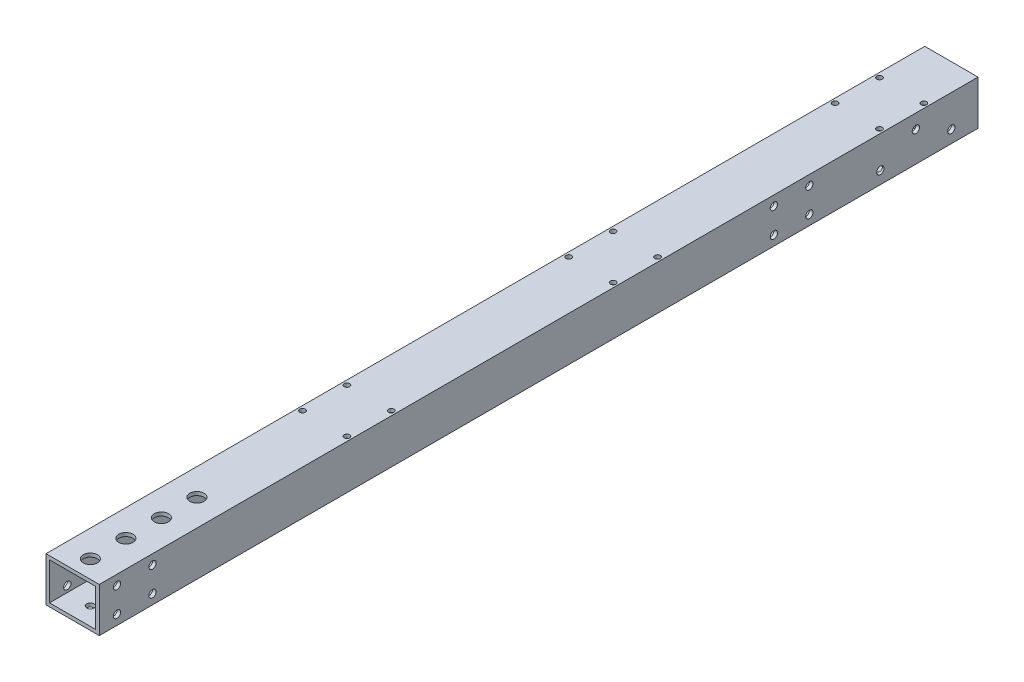
from build123d import *

# Parameters (mm, degrees)
SKETCH_1_W           = 30
SKETCH_1_H           = 25
SKETCH_1_W_2         = 26
SKETCH_1_H_2         = 21
EXTRUDE_1_DEPTH      = 510
CUT_EXTRUDE_4_REACH  = 512.833
SKETCH_7_R           = 2.05
CUT_EXTRUDE_7_DEPTH  = 512.03449003
SKETCH_9_R           = 2.05
CUT_EXTRUDE_9_DEPTH  = 10
SKETCH_10_R          = 4
CUT_EXTRUDE_10_DEPTH = 10
SKETCH_11_R          = 2.05
CUT_EXTRUDE_11_DEPTH = 52
SKETCH_12_W          = 15
SKETCH_12_H          = 25
CUT_EXTRUDE_12_DEPTH = 512.03449003
CUT_EXTRUDE_13_REACH = 512.833
SKETCH_5_R           = 1.55


with BuildPart() as part:
    # 草图1 → 凸台-拉伸1 (new body)
    with BuildSketch(Plane.XY):
        Rectangle(SKETCH_1_W, SKETCH_1_H)
        Rectangle(SKETCH_1_W_2, SKETCH_1_H_2, mode=Mode.SUBTRACT)
    extrude(amount=EXTRUDE_1_DEPTH)

    # 草图4 → 切除-拉伸4 (cut, up to next)
    with BuildSketch(Plane.XZ.offset(12.5), mode=Mode.PRIVATE) as cut_extrude_4_sk1:
        with BuildLine():
            Line((-7.5, 40), (-7.5, 60))
            ThreePointArc((-7.5, 60), (0, 67.5), (7.5, 60))
            Line((7.5, 60), (7.5, 40))
            ThreePointArc((7.5, 40), (0, 32.5), (-7.5, 40))
        make_face()
    cut_extrude_4_tool1 = extrude(cut_extrude_4_sk1.sketch, amount=-CUT_EXTRUDE_4_REACH, mode=Mode.PRIVATE) & part.part
    # 草图4 → 切除-拉伸4 (cut, up to next)
    with BuildSketch(Plane.XZ.offset(12.5), mode=Mode.PRIVATE) as cut_extrude_4_sk2:
        with BuildLine():
            Line((-7.5, 190), (-7.5, 210))
            ThreePointArc((-7.5, 210), (0, 217.5), (7.5, 210))
            Line((7.5, 210), (7.5, 190))
            ThreePointArc((7.5, 190), (0, 182.5), (-7.5, 190))
        make_face()
    cut_extrude_4_tool2 = extrude(cut_extrude_4_sk2.sketch, amount=-CUT_EXTRUDE_4_REACH, mode=Mode.PRIVATE) & part.part
    # 草图4 → 切除-拉伸4 (cut, up to next)
    with BuildSketch(Plane.XZ.offset(12.5), mode=Mode.PRIVATE) as cut_extrude_4_sk3:
        with BuildLine():
            Line((-7.5, 340), (-7.5, 360))
            ThreePointArc((-7.5, 360), (0, 367.5), (7.5, 360))
            Line((7.5, 360), (7.5, 340))
            ThreePointArc((7.5, 340), (0, 332.5), (-7.5, 340))
        make_face()
    cut_extrude_4_tool3 = extrude(cut_extrude_4_sk3.sketch, amount=-CUT_EXTRUDE_4_REACH, mode=Mode.PRIVATE) & part.part
    add(cut_extrude_4_tool1.solids().sort_by_distance((0, -12.5, 50))[0], mode=Mode.SUBTRACT)
    add(cut_extrude_4_tool2.solids().sort_by_distance((0, -12.5, 200))[0], mode=Mode.SUBTRACT)
    add(cut_extrude_4_tool3.solids().sort_by_distance((0, -12.5, 350))[0], mode=Mode.SUBTRACT)

    # 草图7 → 切除-拉伸7 (cut, through all)
    with BuildSketch(Plane(origin=(15, 0, 0), x_dir=(0, 0, -1), z_dir=(1, 0, 0))):
        with Locations((-30, -5.5)):
            Circle(SKETCH_7_R)
        with Locations((-50, 4.5)):
            Circle(SKETCH_7_R)
        with Locations((-70, -5.5)):
            Circle(SKETCH_7_R)
    extrude(amount=-CUT_EXTRUDE_7_DEPTH, mode=Mode.SUBTRACT)

    # 草图9 → 切除-拉伸9 (cut)
    with BuildSketch(Plane.XZ.offset(12.5)):
        with Locations((0, 480)):
            Circle(SKETCH_9_R)
        with Locations((0, 500)):
            Circle(SKETCH_9_R)
        with Locations((0, 440)):
            Circle(SKETCH_9_R)
        with Locations((0, 460)):
            Circle(SKETCH_9_R)
    extrude(amount=-CUT_EXTRUDE_9_DEPTH, mode=Mode.SUBTRACT)

    # 草图10 → 切除-拉伸10 (cut)
    with BuildSketch(Plane(origin=(0, 12.5, 0), x_dir=(1, 0, 0), z_dir=(0, 1, 0))):
        with Locations((0, -500)):
            Circle(SKETCH_10_R)
        with Locations((0, -480)):
            Circle(SKETCH_10_R)
        with Locations((0, -460)):
            Circle(SKETCH_10_R)
        with Locations((0, -440)):
            Circle(SKETCH_10_R)
    extrude(amount=-CUT_EXTRUDE_10_DEPTH, mode=Mode.SUBTRACT)

    # 草图11 → 切除-拉伸11 (cut)
    with BuildSketch(Plane.ZY.offset(15)):
        with Locations((480, 7)):
            Circle(SKETCH_11_R)
        with Locations((500, 7)):
            Circle(SKETCH_11_R)
        with Locations((480, -7)):
            Circle(SKETCH_11_R)
        with Locations((500, -7)):
            Circle(SKETCH_11_R)
        with Locations((110, 7)):
            Circle(SKETCH_11_R)
        with Locations((130, 7)):
            Circle(SKETCH_11_R)
        with Locations((110, -7)):
            Circle(SKETCH_11_R)
        with Locations((130, -7)):
            Circle(SKETCH_11_R)
    extrude(amount=-CUT_EXTRUDE_11_DEPTH, mode=Mode.SUBTRACT)

    # 草图12 → 切除-拉伸12 (cut, through all)
    with BuildSketch(Plane.ZY.offset(15)):
        with Locations((7.5, 0)):
            Rectangle(SKETCH_12_W, SKETCH_12_H)
    extrude(amount=-CUT_EXTRUDE_12_DEPTH, mode=Mode.SUBTRACT)

    # 草图5 → 切除-拉伸13 (cut, up to next)
    with BuildSketch(Plane(origin=(0, 12.5, 0), x_dir=(1, 0, 0), z_dir=(0, 1, 0)), mode=Mode.PRIVATE) as cut_extrude_13_sk1:
        with Locations((-12.5, -43)):
            Circle(SKETCH_5_R)
    cut_extrude_13_tool1 = extrude(cut_extrude_13_sk1.sketch, amount=-CUT_EXTRUDE_13_REACH, mode=Mode.PRIVATE) & part.part
    # 草图5 → 切除-拉伸13 (cut, up to next)
    with BuildSketch(Plane(origin=(0, 12.5, 0), x_dir=(1, 0, 0), z_dir=(0, 1, 0)), mode=Mode.PRIVATE) as cut_extrude_13_sk2:
        with Locations((12.5, -43)):
            Circle(SKETCH_5_R)
    cut_extrude_13_tool2 = extrude(cut_extrude_13_sk2.sketch, amount=-CUT_EXTRUDE_13_REACH, mode=Mode.PRIVATE) & part.part
    # 草图5 → 切除-拉伸13 (cut, up to next)
    with BuildSketch(Plane(origin=(0, 12.5, 0), x_dir=(1, 0, 0), z_dir=(0, 1, 0)), mode=Mode.PRIVATE) as cut_extrude_13_sk3:
        with Locations((-12.5, -68)):
            Circle(SKETCH_5_R)
    cut_extrude_13_tool3 = extrude(cut_extrude_13_sk3.sketch, amount=-CUT_EXTRUDE_13_REACH, mode=Mode.PRIVATE) & part.part
    # 草图5 → 切除-拉伸13 (cut, up to next)
    with BuildSketch(Plane(origin=(0, 12.5, 0), x_dir=(1, 0, 0), z_dir=(0, 1, 0)), mode=Mode.PRIVATE) as cut_extrude_13_sk4:
        with Locations((12.5, -68)):
            Circle(SKETCH_5_R)
    cut_extrude_13_tool4 = extrude(cut_extrude_13_sk4.sketch, amount=-CUT_EXTRUDE_13_REACH, mode=Mode.PRIVATE) & part.part
    # 草图5 → 切除-拉伸13 (cut, up to next)
    with BuildSketch(Plane(origin=(0, 12.5, 0), x_dir=(1, 0, 0), z_dir=(0, 1, 0)), mode=Mode.PRIVATE) as cut_extrude_13_sk5:
        with Locations((-12.5, -193)):
            Circle(SKETCH_5_R)
    cut_extrude_13_tool5 = extrude(cut_extrude_13_sk5.sketch, amount=-CUT_EXTRUDE_13_REACH, mode=Mode.PRIVATE) & part.part
    # 草图5 → 切除-拉伸13 (cut, up to next)
    with BuildSketch(Plane(origin=(0, 12.5, 0), x_dir=(1, 0, 0), z_dir=(0, 1, 0)), mode=Mode.PRIVATE) as cut_extrude_13_sk6:
        with Locations((-12.5, -218)):
            Circle(SKETCH_5_R)
    cut_extrude_13_tool6 = extrude(cut_extrude_13_sk6.sketch, amount=-CUT_EXTRUDE_13_REACH, mode=Mode.PRIVATE) & part.part
    # 草图5 → 切除-拉伸13 (cut, up to next)
    with BuildSketch(Plane(origin=(0, 12.5, 0), x_dir=(1, 0, 0), z_dir=(0, 1, 0)), mode=Mode.PRIVATE) as cut_extrude_13_sk7:
        with Locations((12.5, -193)):
            Circle(SKETCH_5_R)
    cut_extrude_13_tool7 = extrude(cut_extrude_13_sk7.sketch, amount=-CUT_EXTRUDE_13_REACH, mode=Mode.PRIVATE) & part.part
    # 草图5 → 切除-拉伸13 (cut, up to next)
    with BuildSketch(Plane(origin=(0, 12.5, 0), x_dir=(1, 0, 0), z_dir=(0, 1, 0)), mode=Mode.PRIVATE) as cut_extrude_13_sk8:
        with Locations((12.5, -218)):
            Circle(SKETCH_5_R)
    cut_extrude_13_tool8 = extrude(cut_extrude_13_sk8.sketch, amount=-CUT_EXTRUDE_13_REACH, mode=Mode.PRIVATE) & part.part
    # 草图5 → 切除-拉伸13 (cut, up to next)
    with BuildSketch(Plane(origin=(0, 12.5, 0), x_dir=(1, 0, 0), z_dir=(0, 1, 0)), mode=Mode.PRIVATE) as cut_extrude_13_sk9:
        with Locations((-12.5, -343)):
            Circle(SKETCH_5_R)
    cut_extrude_13_tool9 = extrude(cut_extrude_13_sk9.sketch, amount=-CUT_EXTRUDE_13_REACH, mode=Mode.PRIVATE) & part.part
    # 草图5 → 切除-拉伸13 (cut, up to next)
    with BuildSketch(Plane(origin=(0, 12.5, 0), x_dir=(1, 0, 0), z_dir=(0, 1, 0)), mode=Mode.PRIVATE) as cut_extrude_13_sk10:
        with Locations((-12.5, -368)):
            Circle(SKETCH_5_R)
    cut_extrude_13_tool10 = extrude(cut_extrude_13_sk10.sketch, amount=-CUT_EXTRUDE_13_REACH, mode=Mode.PRIVATE) & part.part
    # 草图5 → 切除-拉伸13 (cut, up to next)
    with BuildSketch(Plane(origin=(0, 12.5, 0), x_dir=(1, 0, 0), z_dir=(0, 1, 0)), mode=Mode.PRIVATE) as cut_extrude_13_sk11:
        with Locations((12.5, -343)):
            Circle(SKETCH_5_R)
    cut_extrude_13_tool11 = extrude(cut_extrude_13_sk11.sketch, amount=-CUT_EXTRUDE_13_REACH, mode=Mode.PRIVATE) & part.part
    # 草图5 → 切除-拉伸13 (cut, up to next)
    with BuildSketch(Plane(origin=(0, 12.5, 0), x_dir=(1, 0, 0), z_dir=(0, 1, 0)), mode=Mode.PRIVATE) as cut_extrude_13_sk12:
        with Locations((12.5, -368)):
            Circle(SKETCH_5_R)
    cut_extrude_13_tool12 = extrude(cut_extrude_13_sk12.sketch, amount=-CUT_EXTRUDE_13_REACH, mode=Mode.PRIVATE) & part.part
    add(cut_extrude_13_tool1.solids().sort_by_distance((-12.5, 12.5, 43))[0], mode=Mode.SUBTRACT)
    add(cut_extrude_13_tool2.solids().sort_by_distance((12.5, 12.5, 43))[0], mode=Mode.SUBTRACT)
    add(cut_extrude_13_tool3.solids().sort_by_distance((-12.5, 12.5, 68))[0], mode=Mode.SUBTRACT)
    add(cut_extrude_13_tool4.solids().sort_by_distance((12.5, 12.5, 68))[0], mode=Mode.SUBTRACT)
    add(cut_extrude_13_tool5.solids().sort_by_distance((-12.5, 12.5, 193))[0], mode=Mode.SUBTRACT)
    add(cut_extrude_13_tool6.solids().sort_by_distance((-12.5, 12.5, 218))[0], mode=Mode.SUBTRACT)
    add(cut_extrude_13_tool7.solids().sort_by_distance((12.5, 12.5, 193))[0], mode=Mode.SUBTRACT)
    add(cut_extrude_13_tool8.solids().sort_by_distance((12.5, 12.5, 218))[0], mode=Mode.SUBTRACT)
    add(cut_extrude_13_tool9.solids().sort_by_distance((-12.5, 12.5, 343))[0], mode=Mode.SUBTRACT)
    add(cut_extrude_13_tool10.solids().sort_by_distance((-12.5, 12.5, 368))[0], mode=Mode.SUBTRACT)
    add(cut_extrude_13_tool11.solids().sort_by_distance((12.5, 12.5, 343))[0], mode=Mode.SUBTRACT)
    add(cut_extrude_13_tool12.solids().sort_by_distance((12.5, 12.5, 368))[0], mode=Mode.SUBTRACT)


solid = part.part
